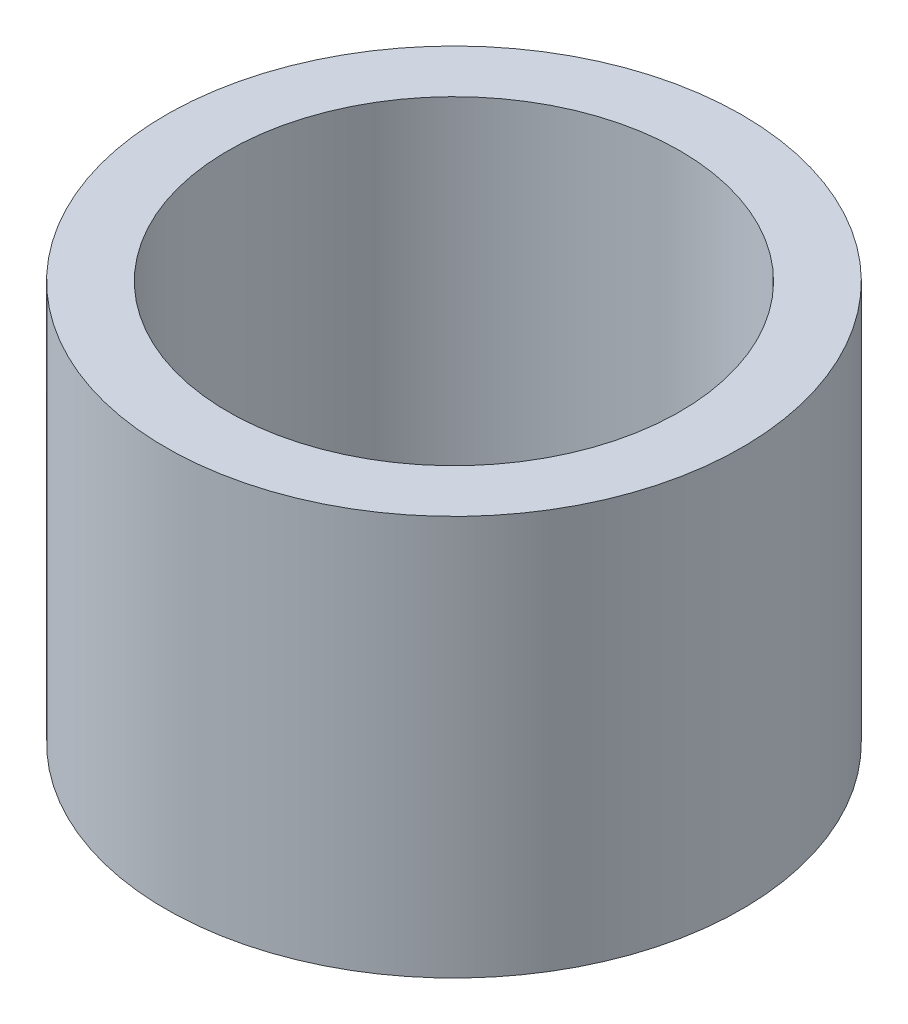
from build123d import *

# Parameters (mm, degrees)
SKETCH1_R           = 20
BOSS_EXTRUDE1_DEPTH = 27.758871841
SKETCH2_R           = 15.691786697
CUT_EXTRUDE1_DEPTH  = 40.630227931


with BuildPart() as part:
    # Sketch1 → Boss-Extrude1 (new body)
    with BuildSketch(Plane(origin=(0, 0, 0), x_dir=(1, 0, 0), z_dir=(0, 1, 0))):
        Circle(SKETCH1_R)
    extrude(amount=BOSS_EXTRUDE1_DEPTH)

    # Sketch2 → Cut-Extrude1 (cut, through all)
    with BuildSketch(Plane(origin=(0, 0, 0), x_dir=(1, 0, 0), z_dir=(0, 1, 0))):
        Circle(SKETCH2_R)
    extrude(amount=CUT_EXTRUDE1_DEPTH, mode=Mode.SUBTRACT)


solid = part.part
